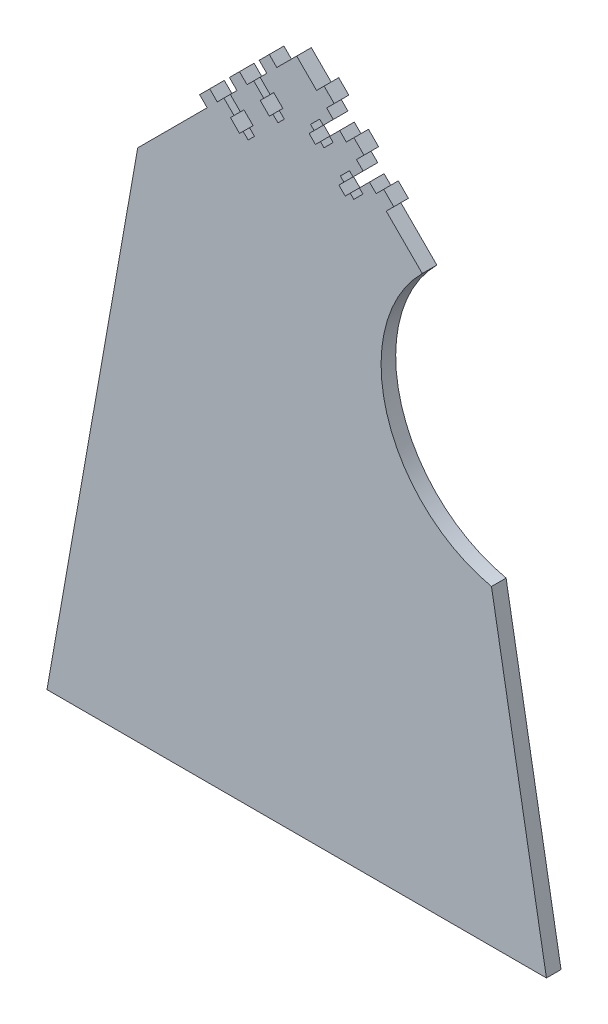
from build123d import *

# Parameters (mm, degrees)
BOSS_EXTRUDE1_DEPTH = 6.604
CUT_EXTRUDE1_DEPTH  = 325.737846372
BOSS_EXTRUDE2_DEPTH = 6.604
SKETCH6_R           = 63.5
CUT_EXTRUDE2_DEPTH  = 325.737846372
MOVE_FACE1_DEPTH    = 6.604


# Read off the part's stored shape, not the designer's step: Move Face1
with BuildPart() as part:
    # Sketch1 → Boss-Extrude1 (new body)
    with BuildSketch(Plane.XY):
        Polygon((0, 304.426146798), (71.842048969, 232.584097829), (112.8529007, 0), (0, 0), (-112.8529007, 0), (-71.842048969, 232.584097829), align=None)
    extrude(amount=BOSS_EXTRUDE1_DEPTH)

    # Sketch4 → Cut-Extrude1 (cut, through all)
    with BuildSketch(Plane.XY.offset(6.604)):
        Polygon((-11.997622178, 283.448268499), (-16.487750238, 287.93839656), (-19.433274246, 284.992872552), (-14.943146185, 280.502744491), (-16.559592287, 278.88629839), (-12.356832423, 274.683538525), (-10.740386321, 276.299984627), (-8.477361778, 274.036960084), (-5.531837771, 276.982484092), (-7.794862313, 279.245508635), (-6.178416211, 280.861954736), (-10.381176076, 285.064714601), align=None)
        Polygon((-25.468006359, 269.977884318), (-29.95813442, 274.468012378), (-32.903658428, 271.52248837), (-28.413530367, 267.03236031), (-30.029976469, 265.415914208), (-25.827216604, 261.213154343), (-24.210770502, 262.829600445), (-21.94774596, 260.566575903), (-19.002221952, 263.51209991), (-21.265246495, 265.775124453), (-19.648800393, 267.391570555), (-23.851560258, 271.594330419), align=None)
        Polygon((16.487750238, 287.93839656), (11.997622178, 283.448268499), (10.381176076, 285.064714601), (6.178416211, 280.861954736), (7.794862313, 279.245508635), (5.531837771, 276.982484092), (8.477361778, 274.036960084), (10.740386321, 276.299984627), (12.356832423, 274.683538525), (16.559592287, 278.88629839), (14.943146185, 280.502744491), (19.433274246, 284.992872552), align=None)
        Polygon((29.95813442, 274.468012378), (25.468006359, 269.977884318), (23.851560258, 271.594330419), (19.648800393, 267.391570555), (21.265246495, 265.775124453), (19.002221952, 263.51209991), (21.94774596, 260.566575903), (24.210770502, 262.829600445), (25.827216604, 261.213154343), (30.029976469, 265.415914208), (28.413530367, 267.03236031), (32.903658428, 271.52248837), align=None)
    extrude(amount=-CUT_EXTRUDE1_DEPTH, mode=Mode.SUBTRACT)

    # Sketch5 → Boss-Extrude2 (add)
    with BuildSketch(Plane.XY.offset(6.604)):
        Polygon((-12.392753447, 298.858388003), (-8.980256121, 295.445890677), (-13.470384182, 290.955762616), (-16.882881508, 294.368259942), align=None)
        Polygon((-25.863137629, 285.388003821), (-22.450640303, 281.975506495), (-26.940768363, 277.485378435), (-30.353265689, 280.897875761), align=None)
        Polygon((-43.823649871, 267.427491579), (-40.411152545, 264.014994253), (-35.921024484, 268.505122314), (-39.33352181, 271.91761964), align=None)
        Polygon((12.392753447, 298.858388003), (8.980256121, 295.445890677), (13.470384182, 290.955762616), (16.882881508, 294.368259942), align=None)
        Polygon((22.450640303, 281.975506495), (25.863137629, 285.388003821), (30.353265689, 280.897875761), (26.940768363, 277.485378435), align=None)
        Polygon((35.921024484, 268.505122314), (39.33352181, 271.91761964), (43.823649871, 267.427491579), (40.411152545, 264.014994253), align=None)
    extrude(amount=-BOSS_EXTRUDE2_DEPTH)

    # Sketch6 → Cut-Extrude2 (cut, through all)
    with BuildSketch(Plane.XY.offset(6.604)):
        with Locations((101.6, 202.826146798)):
            Circle(SKETCH6_R)
    extrude(amount=-CUT_EXTRUDE2_DEPTH, mode=Mode.SUBTRACT)

    # Move Face1 outline → Move Face1 (add)
    with BuildSketch(Plane.XY):
        with BuildLine():
            Line((56.770575824, 247.727413023), (40.482994594, 264.014994253))
            Line((40.482994594, 264.014994253), (43.89549192, 267.427491579))
            Line((43.89549192, 267.427491579), (39.33352181, 271.989461689))
            Line((39.33352181, 271.989461689), (35.921024484, 268.576964363))
            Line((35.921024484, 268.576964363), (32.903658428, 271.594330419))
            Line((32.903658428, 271.594330419), (28.341688318, 267.03236031))
            Line((28.341688318, 267.03236031), (29.95813442, 265.415914208))
            Line((29.95813442, 265.415914208), (25.827216604, 261.284996392))
            Line((25.827216604, 261.284996392), (24.210770502, 262.901442494))
            Line((24.210770502, 262.901442494), (21.94774596, 260.638417952))
            Line((21.94774596, 260.638417952), (19.074064001, 263.51209991))
            Line((19.074064001, 263.51209991), (21.337088544, 265.775124453))
            Line((21.337088544, 265.775124453), (19.720642442, 267.391570555))
            Line((19.720642442, 267.391570555), (23.851560258, 271.52248837))
            Line((23.851560258, 271.52248837), (25.468006359, 269.906042269))
            Line((25.468006359, 269.906042269), (30.029976469, 274.468012378))
            Line((30.029976469, 274.468012378), (27.012610412, 277.485378435))
            Line((27.012610412, 277.485378435), (30.425107738, 280.897875761))
            Line((30.425107738, 280.897875761), (25.863137629, 285.45984587))
            Line((25.863137629, 285.45984587), (22.450640303, 282.047348544))
            Line((22.450640303, 282.047348544), (19.433274246, 285.064714601))
            Line((19.433274246, 285.064714601), (14.871304136, 280.502744491))
            Line((14.871304136, 280.502744491), (16.487750238, 278.88629839))
            Line((16.487750238, 278.88629839), (12.356832423, 274.755380574))
            Line((12.356832423, 274.755380574), (10.740386321, 276.371826676))
            Line((10.740386321, 276.371826676), (8.477361778, 274.108802133))
            Line((8.477361778, 274.108802133), (5.60367982, 276.982484092))
            Line((5.60367982, 276.982484092), (7.866704362, 279.245508635))
            Line((7.866704362, 279.245508635), (6.25025826, 280.861954736))
            Line((6.25025826, 280.861954736), (10.381176076, 284.992872552))
            Line((10.381176076, 284.992872552), (11.997622178, 283.37642645))
            Line((11.997622178, 283.37642645), (16.559592287, 287.93839656))
            Line((16.559592287, 287.93839656), (13.542226231, 290.955762616))
            Line((13.542226231, 290.955762616), (16.954723557, 294.368259942))
            Line((16.954723557, 294.368259942), (12.392753447, 298.930230052))
            Line((12.392753447, 298.930230052), (8.980256121, 295.517732726))
            Line((8.980256121, 295.517732726), (0, 304.497988847))
            Line((0, 304.497988847), (-8.980256121, 295.517732726))
            Line((-8.980256121, 295.517732726), (-12.392753447, 298.930230052))
            Line((-12.392753447, 298.930230052), (-16.954723557, 294.368259942))
            Line((-16.954723557, 294.368259942), (-13.542226231, 290.955762616))
            Line((-13.542226231, 290.955762616), (-16.559592287, 287.93839656))
            Line((-16.559592287, 287.93839656), (-11.997622178, 283.37642645))
            Line((-11.997622178, 283.37642645), (-10.381176076, 284.992872552))
            Line((-10.381176076, 284.992872552), (-6.25025826, 280.861954736))
            Line((-6.25025826, 280.861954736), (-7.866704362, 279.245508635))
            Line((-7.866704362, 279.245508635), (-5.60367982, 276.982484092))
            Line((-5.60367982, 276.982484092), (-8.477361778, 274.108802133))
            Line((-8.477361778, 274.108802133), (-10.740386321, 276.371826676))
            Line((-10.740386321, 276.371826676), (-12.356832423, 274.755380574))
            Line((-12.356832423, 274.755380574), (-16.487750238, 278.88629839))
            Line((-16.487750238, 278.88629839), (-14.871304136, 280.502744491))
            Line((-14.871304136, 280.502744491), (-19.433274246, 285.064714601))
            Line((-19.433274246, 285.064714601), (-22.450640303, 282.047348544))
            Line((-22.450640303, 282.047348544), (-25.863137629, 285.45984587))
            Line((-25.863137629, 285.45984587), (-30.425107738, 280.897875761))
            Line((-30.425107738, 280.897875761), (-27.012610412, 277.485378435))
            Line((-27.012610412, 277.485378435), (-30.029976469, 274.468012378))
            Line((-30.029976469, 274.468012378), (-25.468006359, 269.906042269))
            Line((-25.468006359, 269.906042269), (-23.851560258, 271.52248837))
            Line((-23.851560258, 271.52248837), (-19.720642442, 267.391570555))
            Line((-19.720642442, 267.391570555), (-21.337088544, 265.775124453))
            Line((-21.337088544, 265.775124453), (-19.074064001, 263.51209991))
            Line((-19.074064001, 263.51209991), (-21.94774596, 260.638417952))
            Line((-21.94774596, 260.638417952), (-24.210770502, 262.901442494))
            Line((-24.210770502, 262.901442494), (-25.827216604, 261.284996392))
            Line((-25.827216604, 261.284996392), (-29.95813442, 265.415914208))
            Line((-29.95813442, 265.415914208), (-28.341688318, 267.03236031))
            Line((-28.341688318, 267.03236031), (-32.903658428, 271.594330419))
            Line((-32.903658428, 271.594330419), (-35.921024484, 268.576964363))
            Line((-35.921024484, 268.576964363), (-39.33352181, 271.989461689))
            Line((-39.33352181, 271.989461689), (-43.89549192, 267.427491579))
            Line((-43.89549192, 267.427491579), (-40.482994594, 264.014994253))
            Line((-40.482994594, 264.014994253), (-71.889295849, 232.608692998))
            Line((-71.889295849, 232.608692998), (-112.913441782, -0.0508))
            Line((-112.913441782, -0.0508), (112.913441782, -0.0508))
            Line((112.913441782, -0.0508), (88.071293124, 140.836026046))
            ThreePointArc((88.071293124, 140.836026046), (40.707800027, 184.995247686), (56.770575824, 247.727413023))
        make_face()
        with BuildLine():
            Line((43.823649871, 267.427491579), (40.411152545, 264.014994253))
            Line((40.411152545, 264.014994253), (56.698719395, 247.727427403))
            ThreePointArc((56.698719395, 247.727427403), (40.661404518, 184.972923541), (88.027178445, 140.793667281))
            Line((88.027178445, 140.793667281), (112.8529007, 0))
            Line((112.8529007, 0), (-112.8529007, 0))
            Line((-112.8529007, 0), (-71.842048969, 232.584097829))
            Line((-71.842048969, 232.584097829), (-40.411152545, 264.014994253))
            Line((-40.411152545, 264.014994253), (-43.823649871, 267.427491579))
            Line((-43.823649871, 267.427491579), (-39.33352181, 271.91761964))
            Line((-39.33352181, 271.91761964), (-35.921024484, 268.505122314))
            Line((-35.921024484, 268.505122314), (-32.903658428, 271.52248837))
            Line((-32.903658428, 271.52248837), (-28.413530367, 267.03236031))
            Line((-28.413530367, 267.03236031), (-30.029976469, 265.415914208))
            Line((-30.029976469, 265.415914208), (-25.827216604, 261.213154343))
            Line((-25.827216604, 261.213154343), (-24.210770502, 262.829600445))
            Line((-24.210770502, 262.829600445), (-21.94774596, 260.566575903))
            Line((-21.94774596, 260.566575903), (-19.002221952, 263.51209991))
            Line((-19.002221952, 263.51209991), (-21.265246495, 265.775124453))
            Line((-21.265246495, 265.775124453), (-19.648800393, 267.391570555))
            Line((-19.648800393, 267.391570555), (-23.851560258, 271.594330419))
            Line((-23.851560258, 271.594330419), (-25.468006359, 269.977884318))
            Line((-25.468006359, 269.977884318), (-29.95813442, 274.468012378))
            Line((-29.95813442, 274.468012378), (-26.940768363, 277.485378435))
            Line((-26.940768363, 277.485378435), (-30.353265689, 280.897875761))
            Line((-30.353265689, 280.897875761), (-25.863137629, 285.388003821))
            Line((-25.863137629, 285.388003821), (-22.450640303, 281.975506495))
            Line((-22.450640303, 281.975506495), (-19.433274246, 284.992872552))
            Line((-19.433274246, 284.992872552), (-14.943146185, 280.502744491))
            Line((-14.943146185, 280.502744491), (-16.559592287, 278.88629839))
            Line((-16.559592287, 278.88629839), (-12.356832423, 274.683538525))
            Line((-12.356832423, 274.683538525), (-10.740386321, 276.299984627))
            Line((-10.740386321, 276.299984627), (-8.477361778, 274.036960084))
            Line((-8.477361778, 274.036960084), (-5.531837771, 276.982484092))
            Line((-5.531837771, 276.982484092), (-7.794862313, 279.245508635))
            Line((-7.794862313, 279.245508635), (-6.178416211, 280.861954736))
            Line((-6.178416211, 280.861954736), (-10.381176076, 285.064714601))
            Line((-10.381176076, 285.064714601), (-11.997622178, 283.448268499))
            Line((-11.997622178, 283.448268499), (-16.487750238, 287.93839656))
            Line((-16.487750238, 287.93839656), (-13.470384182, 290.955762616))
            Line((-13.470384182, 290.955762616), (-16.882881508, 294.368259942))
            Line((-16.882881508, 294.368259942), (-12.392753447, 298.858388003))
            Line((-12.392753447, 298.858388003), (-8.980256121, 295.445890677))
            Line((-8.980256121, 295.445890677), (0, 304.426146798))
            Line((0, 304.426146798), (8.980256121, 295.445890677))
            Line((8.980256121, 295.445890677), (12.392753447, 298.858388003))
            Line((12.392753447, 298.858388003), (16.882881508, 294.368259942))
            Line((16.882881508, 294.368259942), (13.470384182, 290.955762616))
            Line((13.470384182, 290.955762616), (16.487750238, 287.93839656))
            Line((16.487750238, 287.93839656), (11.997622178, 283.448268499))
            Line((11.997622178, 283.448268499), (10.381176076, 285.064714601))
            Line((10.381176076, 285.064714601), (6.178416211, 280.861954736))
            Line((6.178416211, 280.861954736), (7.794862313, 279.245508635))
            Line((7.794862313, 279.245508635), (5.531837771, 276.982484092))
            Line((5.531837771, 276.982484092), (8.477361778, 274.036960084))
            Line((8.477361778, 274.036960084), (10.740386321, 276.299984627))
            Line((10.740386321, 276.299984627), (12.356832423, 274.683538525))
            Line((12.356832423, 274.683538525), (16.559592287, 278.88629839))
            Line((16.559592287, 278.88629839), (14.943146185, 280.502744491))
            Line((14.943146185, 280.502744491), (19.433274246, 284.992872552))
            Line((19.433274246, 284.992872552), (22.450640303, 281.975506495))
            Line((22.450640303, 281.975506495), (25.863137629, 285.388003821))
            Line((25.863137629, 285.388003821), (30.353265689, 280.897875761))
            Line((30.353265689, 280.897875761), (26.940768363, 277.485378435))
            Line((26.940768363, 277.485378435), (29.95813442, 274.468012378))
            Line((29.95813442, 274.468012378), (25.468006359, 269.977884318))
            Line((25.468006359, 269.977884318), (23.851560258, 271.594330419))
            Line((23.851560258, 271.594330419), (19.648800393, 267.391570555))
            Line((19.648800393, 267.391570555), (21.265246495, 265.775124453))
            Line((21.265246495, 265.775124453), (19.002221952, 263.51209991))
            Line((19.002221952, 263.51209991), (21.94774596, 260.566575903))
            Line((21.94774596, 260.566575903), (24.210770502, 262.829600445))
            Line((24.210770502, 262.829600445), (25.827216604, 261.213154343))
            Line((25.827216604, 261.213154343), (30.029976469, 265.415914208))
            Line((30.029976469, 265.415914208), (28.413530367, 267.03236031))
            Line((28.413530367, 267.03236031), (32.903658428, 271.52248837))
            Line((32.903658428, 271.52248837), (35.921024484, 268.505122314))
            Line((35.921024484, 268.505122314), (39.33352181, 271.91761964))
            Line((39.33352181, 271.91761964), (43.823649871, 267.427491579))
        make_face(mode=Mode.SUBTRACT)
    extrude(amount=MOVE_FACE1_DEPTH)


solid = part.part
